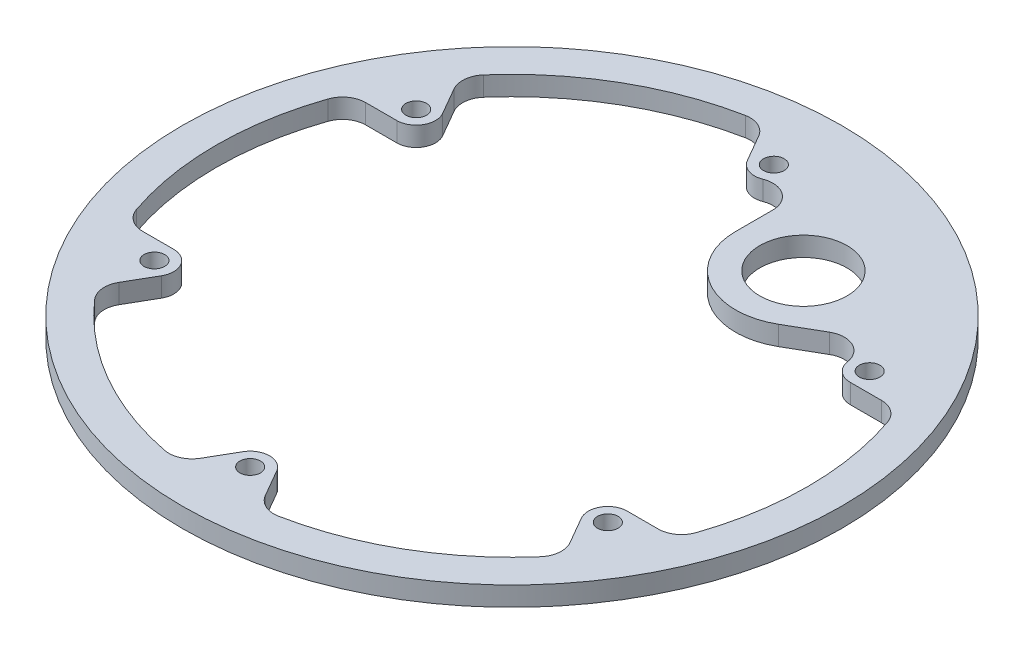
from build123d import *

# Parameters (mm, degrees)
SKETCH1_R                   = 107.95
SKETCH1_R_2                 = 96.8375
BOSS_EXTRUDE1_DEPTH         = 3.175
SKETCH2_R                   = 2.38125
BOSS_EXTRUDE2_START         = -6.35
BOSS_EXTRUDE2_DEPTH         = 6.35
BOSS_EXTRUDE3_START         = -6.35
SKETCH7_R                   = 14.2875
BOSS_EXTRUDE3_DEPTH         = 6.35
FILLET1_R                   = 7.62
CIRPATTERN1_START           = -3.175
CIRPATTERN1_DEPTH           = 6.35
F_1_4_CLEARANCE_HOLE1_D     = 6.7564
F_1_4_CLEARANCE_HOLE1_DEPTH = 9.398
F_1_4_CLEARANCE_HOLE1_TIP   = 2.029827343
FILLET2_R                   = 7.62


# Read off the part's stored shape, not the designer's step: CirPattern1
with BuildPart() as part:
    # Sketch1 → Boss-Extrude1 (new, symmetric)
    with BuildSketch(Plane(origin=(0, 0, 0), x_dir=(1, 0, 0), z_dir=(0, 1, 0))):
        with Locations(Location((0, 0, 0), (0, 0, 270))):
            Circle(SKETCH1_R)
        with Locations(Location((0, 0, 0), (0, 0, 270))):
            Circle(SKETCH1_R_2, mode=Mode.SUBTRACT)
    extrude(amount=BOSS_EXTRUDE1_DEPTH, both=True)

    # Sketch2 → Cut-Revolve1 (revolve, cut)
    with BuildSketch(Plane(origin=(0, 0, 0), x_dir=(0, 0, -1), z_dir=(1, 0, 0)), mode=Mode.PRIVATE) as cut_revolve1_sk:
        with Locations((-101.6, -4.445)):
            Circle(SKETCH2_R)
    revolve(cut_revolve1_sk.sketch.rotate(Axis((0, -31.187956177, 0), (0, 1, 0)), 180), axis=Axis((0, -31.187956177, 0), (0, 1, 0)), mode=Mode.SUBTRACT)

    # Sketch3 → Boss-Extrude2 (add)
    with BuildSketch(Plane(origin=(0, 3.175, 0), x_dir=(1, 0, 0), z_dir=(0, 1, 0)).offset(BOSS_EXTRUDE2_START)):
        with BuildLine():
            Line((-5.499261314, -82.55), (-13.224366326, -95.930274374))
            ThreePointArc((-13.224366326, -95.930274374), (0, -96.8375), (13.224366326, -95.930274374))
            Line((13.224366326, -95.930274374), (5.499261314, -82.55))
            ThreePointArc((5.499261314, -82.55), (0, -79.375), (-5.499261314, -82.55))
        make_face()
    extrude(amount=BOSS_EXTRUDE2_DEPTH)

    # Sketch7 → Boss-Extrude3 (add)
    with BuildSketch(Plane(origin=(0, 3.175, 0), x_dir=(1, 0, 0), z_dir=(0, 1, 0)).offset(BOSS_EXTRUDE3_START)):
        with BuildLine():
            ThreePointArc((76.789392316, 58.999073162), (48.41875, 83.863735039), (12.7, 96.001101068))
            Line((12.7, 96.001101068), (12.7, 60.491874454))
            ThreePointArc((12.7, 60.491874454), (23.8125, 41.244459855), (46.0375, 41.244459855))
            Line((46.0375, 41.244459855), (76.789392316, 58.999073162))
        make_face()
        with Locations(Location((34.925, 60.491874454, 0), (0, 0, 270))):
            Circle(SKETCH7_R, mode=Mode.SUBTRACT)
    extrude(amount=BOSS_EXTRUDE3_DEPTH)

    # Fillet1
    fillet1_edges = [part.edges().sort_by_distance(p)[0] for p in [
        (-13.224366326, 0, 95.930274374),
        (13.224366326, 0, 95.930274374),
    ]]
    fillet(fillet1_edges, radius=FILLET1_R)

    # CirPattern1 outline → CirPattern1 (add)
    with BuildSketch(Plane(origin=(0, 0, 0), x_dir=(1, 0, 0), z_dir=(0, 1, 0)).offset(CIRPATTERN1_START)):
        with BuildLine():
            ThreePointArc((72.968215537, -63.664282982), (83.863735039, -48.41875), (91.618994144, -31.360186833))
            ThreePointArc((91.618994144, -31.360186833), (88.840241596, -35.092023113), (84.409630671, -36.5125))
            Line((84.409630671, -36.5125), (74.240027739, -36.5125))
            ThreePointArc((74.240027739, -36.5125), (68.740766425, -39.6875), (68.740766425, -46.0375))
            Line((68.740766425, -46.0375), (73.825567891, -54.844634485))
            ThreePointArc((73.825567891, -54.844634485), (74.810704284, -59.391894543), (72.968215537, -63.664282982))
        make_face()
        with BuildLine():
            Line((75.941505111, 58.509545256), (68.740766425, 46.0375))
            ThreePointArc((68.740766425, 46.0375), (68.740766425, 39.6875), (74.240027739, 36.5125))
            Line((74.240027739, 36.5125), (84.409630671, 36.5125))
            ThreePointArc((84.409630671, 36.5125), (88.840241596, 35.092023113), (91.618994145, 31.360186833))
            ThreePointArc((91.618994145, 31.360186833), (85.330669556, 45.784039133), (76.789392316, 58.999073162))
            Line((76.789392316, 58.999073162), (75.941505111, 58.509545256))
        make_face()
        with BuildLine():
            ThreePointArc((-84.409630671, -36.5125), (-88.840241596, -35.092023113), (-91.618994145, -31.360186833))
            ThreePointArc((-91.618994145, -31.360186833), (-83.863735039, -48.41875), (-72.968215537, -63.664282982))
            ThreePointArc((-72.968215537, -63.664282982), (-74.810704284, -59.391894543), (-73.825567891, -54.844634485))
            Line((-73.825567891, -54.844634485), (-68.740766425, -46.0375))
            ThreePointArc((-68.740766425, -46.0375), (-68.740766425, -39.6875), (-74.240027739, -36.5125))
            Line((-74.240027739, -36.5125), (-84.409630671, -36.5125))
        make_face()
        with BuildLine():
            ThreePointArc((12.7, 96.001101068), (-3.015193802, 96.790547124), (-18.650778608, 95.024469815))
            ThreePointArc((-18.650778608, 95.024469815), (-14.029537312, 94.483917657), (-10.58406278, 91.357134485))
            Line((-10.58406278, 91.357134485), (-5.499261314, 82.55))
            ThreePointArc((-5.499261314, 82.55), (0, 79.375), (5.499261314, 82.55))
            Line((5.499261314, 82.55), (12.7, 95.022045256))
            Line((12.7, 95.022045256), (12.7, 96.001101068))
        make_face()
        with BuildLine():
            Line((-68.740766425, 46.0375), (-73.825567891, 54.844634485))
            ThreePointArc((-73.825567891, 54.844634485), (-74.810704284, 59.391894543), (-72.968215537, 63.664282982))
            ThreePointArc((-72.968215537, 63.664282982), (-83.863735039, 48.41875), (-91.618994145, 31.360186833))
            ThreePointArc((-91.618994145, 31.360186833), (-88.840241596, 35.092023113), (-84.409630671, 36.5125))
            Line((-84.409630671, 36.5125), (-74.240027739, 36.5125))
            ThreePointArc((-74.240027739, 36.5125), (-68.740766425, 39.6875), (-68.740766425, 46.0375))
        make_face()
    extrude(amount=CIRPATTERN1_DEPTH)

    # 1/4 Clearance Hole1
    with Locations(Plane(origin=(0, 3.175, 0), x_dir=(1, 0, 0), z_dir=(0, 1, 0))):
        with Locations((0, -85.725), (74.240027739, -42.8625), (74.240027739, 42.8625), (-74.240027739, 42.8625), (-74.240027739, -42.8625), (0, 85.725)):
            Hole(F_1_4_CLEARANCE_HOLE1_D / 2, depth=F_1_4_CLEARANCE_HOLE1_DEPTH)
            with Locations((0, 0, -(F_1_4_CLEARANCE_HOLE1_DEPTH + F_1_4_CLEARANCE_HOLE1_TIP / 2))):  # 118° drill point
                Cone(0, F_1_4_CLEARANCE_HOLE1_D / 2, F_1_4_CLEARANCE_HOLE1_TIP, mode=Mode.SUBTRACT)

    # Fillet2
    fillet2_edges = [part.edges().sort_by_distance(p)[0] for p in [
        (75.941505111, 0, -58.509545256),
        (12.7, 0, -95.022045256),
    ]]
    fillet(fillet2_edges, radius=FILLET2_R)


solid = part.part
